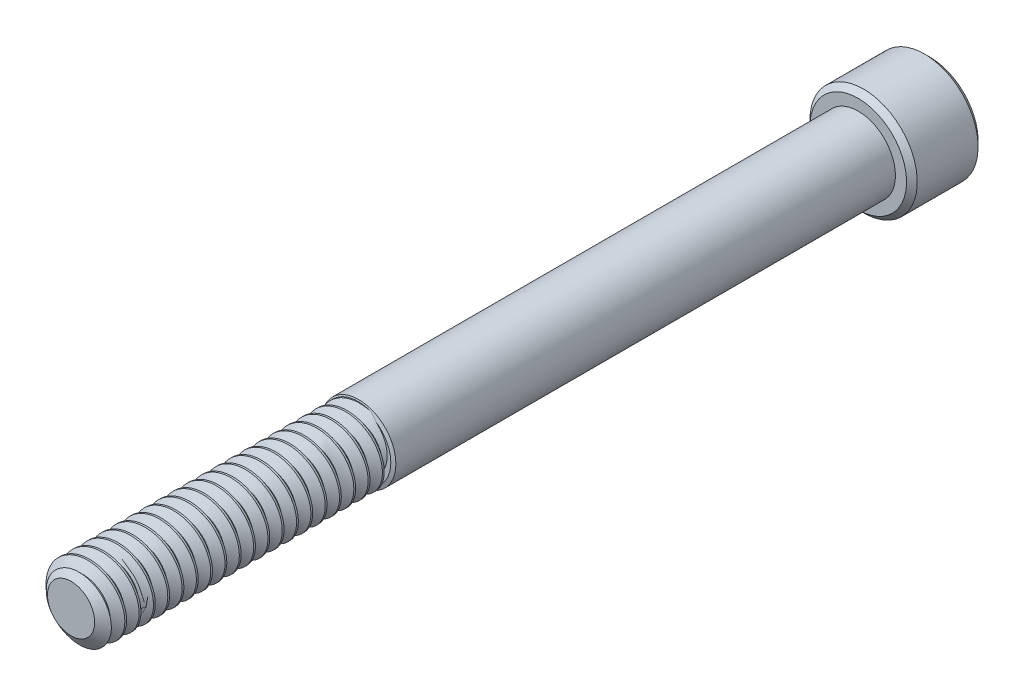
from build123d import *

# Parameters (mm, degrees)
SKETCH1_R          = 3.175
EXTRUDE1_DEPTH     = 69.85
CUT_SWEEP1_PITCH   = 1.27
SKETCH6_R          = 4.7625
EXTRUDE2_DEPTH     = 6.35
CUT_EXTRUDE1_DEPTH = 3.571875
CHAMFER1_SIZE      = 0.47625


with BuildPart() as part:
    # Sketch1 → Extrude1 (new body)
    with BuildSketch(Plane.XY):
        Circle(SKETCH1_R)
    extrude(amount=-EXTRUDE1_DEPTH)

    # Cut-Sweep1: arcs per turn and ends read off the stored shape
    # Cut-Sweep1: the profile of Sketch3 profile screwed along a right-hand helix through 58 turns, 6 arcs to a turn; built about Z, then put on its axis
    cut_sweep1_z = Axis((0, 0, 0), (0, 0, 1))
    cut_sweep1_corners = [(3.1753, 0, -2.381423205), (2.350110803, 0, -1.905), (2.350110803, 0, -1.74625), (3.1753, 0, -1.269826795)]
    with BuildLine(mode=Mode.PRIVATE) as cut_sweep1_profile:
        Line(cut_sweep1_corners[0], cut_sweep1_corners[1])
        Line(cut_sweep1_corners[1], cut_sweep1_corners[2])
        Line(cut_sweep1_corners[2], cut_sweep1_corners[3])
        Line(cut_sweep1_corners[3], cut_sweep1_corners[0])
    cut_sweep1_cap = Face(cut_sweep1_profile.wire())
    cut_sweep1_turn_angles = [0, 30, 60, 90, 120, 150, 180, 210, 240, 270, 300, 330, 360]
    cut_sweep1_turn_weights = [1, 0.8660254037844387, 1, 0.8660254037844387, 1, 0.8660254037844387, 1, 0.8660254037844387, 1, 0.8660254037844387, 1, 0.8660254037844387, 1]
    cut_sweep1_turn_rails = [Edge.make_bspline([Vector(p[0], p[1], 0).rotate(cut_sweep1_z, cut_sweep1_turn_angles[k]) / cut_sweep1_turn_weights[k] + Vector(0, 0, p[2] + CUT_SWEEP1_PITCH * cut_sweep1_turn_angles[k] / 360) for k in range(13)], [0, 0, 0, 1, 1, 2, 2, 3, 3, 4, 4, 5, 5, 6, 6, 6], 2, cut_sweep1_turn_weights) for p in cut_sweep1_corners]
    cut_sweep1_turn_sides = [Face.make_surface_from_curves(cut_sweep1_turn_rails[p[0]], cut_sweep1_turn_rails[p[1]]) for p in [(0, 1), (1, 2), (2, 3), (3, 0)]]
    cut_sweep1 = Plane(origin=(0, 0, 0), x_dir=(0, 1, 0), z_dir=(0, 0, -1)) * Solid(Shell([*[p.moved(Location((0, 0, CUT_SWEEP1_PITCH * i))) for i in range(58) for p in cut_sweep1_turn_sides], cut_sweep1_cap, cut_sweep1_cap.rotate(cut_sweep1_z, 20880).moved(Location((0, 0, CUT_SWEEP1_PITCH * 20880 / 360)))]))
    add(cut_sweep1, mode=Mode.SUBTRACT)

    # Sketch4 → Cut-Revolve1 (revolve, cut)
    with BuildSketch(Plane(origin=(0, 0, 0), x_dir=(0, 0, -1), z_dir=(1, 0, 0)), mode=Mode.PRIVATE) as cut_revolve1_sk:
        Polygon((0.755446349, 3.175), (0, 2.096110803), (0, 3.175), align=None)
    revolve(cut_revolve1_sk.sketch.rotate(Axis((0, 0, 0), (0, 0, -1)), 270), axis=Axis((0, 0, 0), (0, 0, -1)), mode=Mode.SUBTRACT)

    # Sketch5 → partially thread (revolve)
    with BuildSketch(Plane(origin=(0, 0, 0), x_dir=(0, 0, -1), z_dir=(1, 0, 0)), mode=Mode.PRIVATE) as partially_thread_sk:
        Polygon((69.85, 3.302), (25.520182971, 3.302), (25.4, 2.9718), (25.4, 0), (69.85, 0), align=None)
    revolve(partially_thread_sk.sketch.rotate(Axis((0, 0, 0), (0, 0, -1)), 270), axis=Axis((0, 0, 0), (0, 0, -1)))

    # Sketch6 → Extrude2 (add)
    with BuildSketch(Plane(origin=(0, 0, -69.85), x_dir=(-1, 0, 0), z_dir=(0, 0, -1))):
        Circle(SKETCH6_R)
    extrude(amount=EXTRUDE2_DEPTH)

    # Sketch7 → Cut-Extrude1 (cut)
    with BuildSketch(Plane(origin=(0, 0, -76.2), x_dir=(-1, 0, 0), z_dir=(0, 0, -1))):
        Polygon((0, 2.749630657), (-2.38125, 1.374815329), (-2.38125, -1.374815329), (0, -2.749630657), (2.38125, -1.374815329), (2.38125, 1.374815329), align=None)
    extrude(amount=-CUT_EXTRUDE1_DEPTH, mode=Mode.SUBTRACT)

    # Cut-Extrude2 cone 1 section (through the dimple's axis) → Cut-Extrude2 (revolve, cut)
    with BuildSketch(Plane(origin=(0, 0, -76.2), x_dir=(0, 1, 0), z_dir=(1, 0, 0))):
        Polygon((0, 0), (2.749630657, 0), (0, 2.749630657), align=None)
    revolve(axis=Axis((0, 0, -76.2), (0, 0, 1)), mode=Mode.SUBTRACT)

    # Chamfer1
    chamfer1_edges = [part.edges().sort_by_distance(p)[0] for p in [
        (4.7625, 0, -69.85),
        (4.7625, 0, -76.2),
    ]]
    chamfer(chamfer1_edges, length=CHAMFER1_SIZE)


solid = part.part
